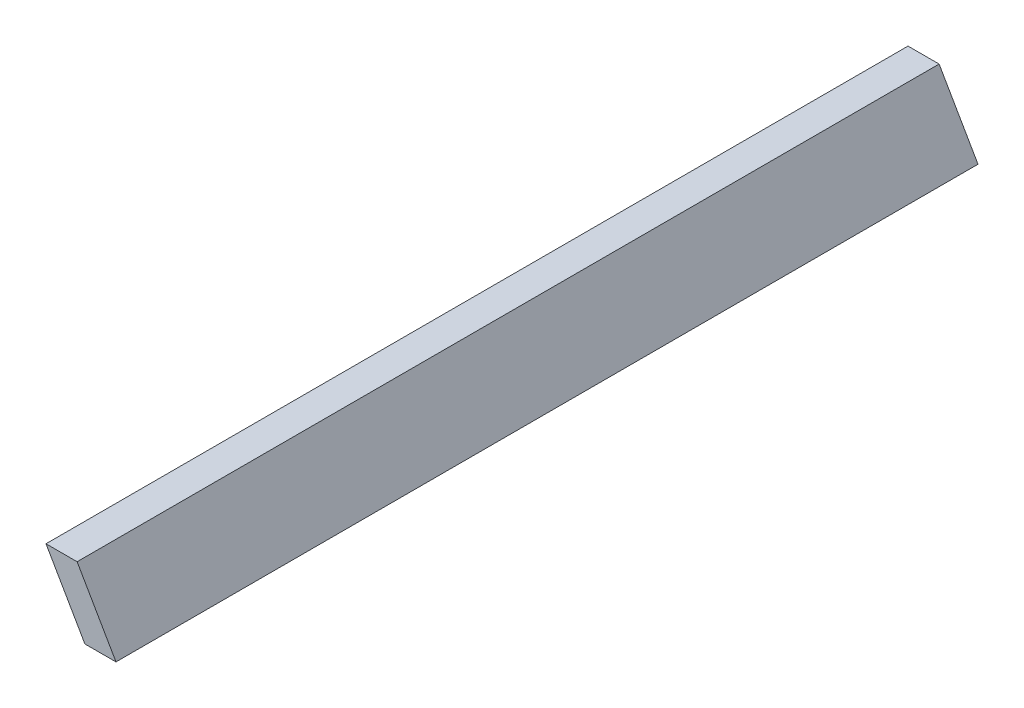
from build123d import *

# Parameters (mm, degrees)
BOSS_EXTRUDE1_DEPTH = 203.2
CUT_EXTRUDE1_DEPTH  = 7.112


with BuildPart() as part:
    # end-profile → Boss-Extrude1 (new body)
    with BuildSketch(Plane.XY):
        Polygon((0, 0), (-7.332348419, 0), (-16.497783942, 15.875), (-9.165435523, 15.875), align=None)
    extrude(amount=BOSS_EXTRUDE1_DEPTH)

    # Sketch4 → Cut-Extrude1 (cut)
    with BuildSketch(Plane(origin=(-16.497783942, 0, 0), x_dir=(0, 0, -1), z_dir=(1, 0, 0))):
        with BuildLine():
            Line((-181.18709, 7.9375), (-181.18709, 0))
            Line((-181.18709, 0), (-174.41291, 0))
            Line((-174.41291, 0), (-174.41291, 7.9375))
            ThreePointArc((-174.41291, 7.9375), (-177.8, 11.32459), (-181.18709, 7.9375))
        make_face()
        with BuildLine():
            Line((-143.08709, 7.9375), (-143.08709, 0))
            Line((-143.08709, 0), (-136.31291, 0))
            Line((-136.31291, 0), (-136.31291, 7.9375))
            ThreePointArc((-136.31291, 7.9375), (-139.7, 11.32459), (-143.08709, 7.9375))
        make_face()
        with BuildLine():
            Line((-104.98709, 7.9375), (-104.98709, 0))
            Line((-104.98709, 0), (-98.21291, 0))
            Line((-98.21291, 0), (-98.21291, 7.9375))
            ThreePointArc((-98.21291, 7.9375), (-101.6, 11.32459), (-104.98709, 7.9375))
        make_face()
        with BuildLine():
            Line((-66.88709, 7.9375), (-66.88709, 0))
            Line((-66.88709, 0), (-60.11291, 0))
            Line((-60.11291, 0), (-60.11291, 7.9375))
            ThreePointArc((-60.11291, 7.9375), (-63.5, 11.32459), (-66.88709, 7.9375))
        make_face()
        with BuildLine():
            Line((-28.78709, 7.9375), (-28.78709, 0))
            Line((-28.78709, 0), (-22.01291, 0))
            Line((-22.01291, 0), (-22.01291, 7.9375))
            ThreePointArc((-22.01291, 7.9375), (-25.4, 11.32459), (-28.78709, 7.9375))
        make_face()
    extrude(amount=CUT_EXTRUDE1_DEPTH, mode=Mode.SUBTRACT)


solid = part.part
